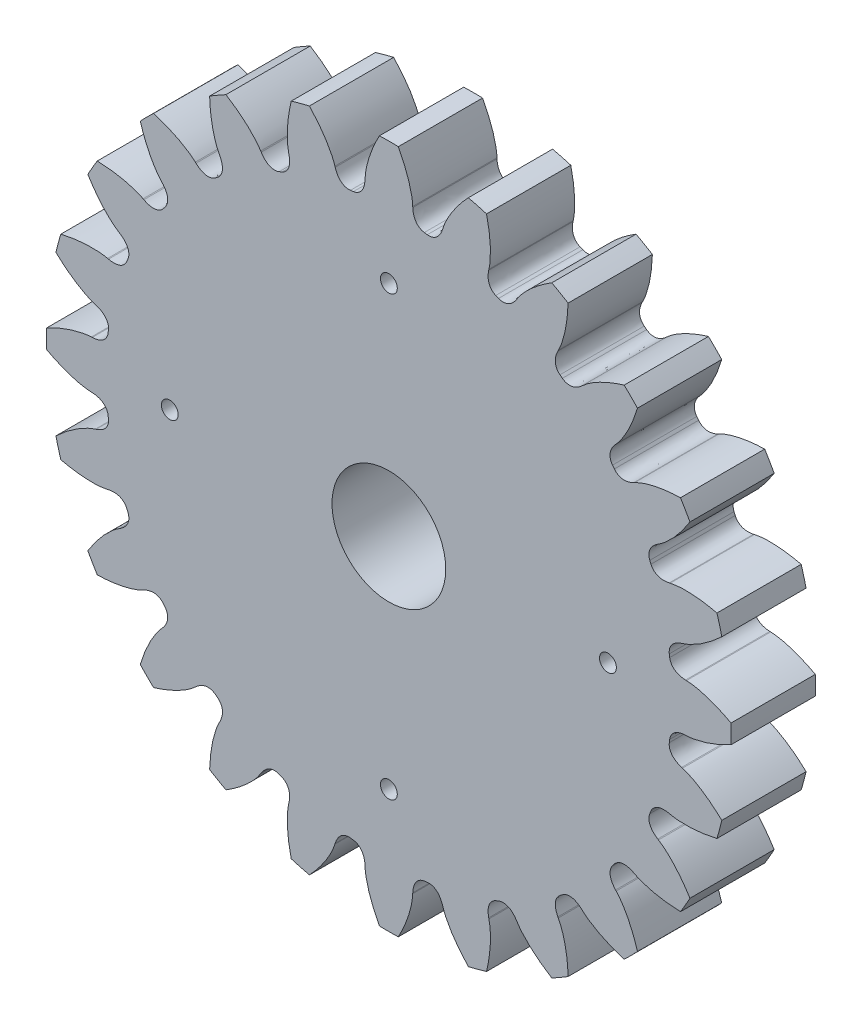
from build123d import *

# Parameters (mm, degrees)
BOSS_EXTRUDE1_DEPTH = 2.54
SKETCH2_R           = 0.254
SKETCH2_R_2         = 1.7145
CUT_EXTRUDE1_DEPTH  = 15.812319459


with BuildPart() as part:
    # Sketch1 → Boss-Extrude1 (new body)
    with BuildSketch(Plane.XY):
        with BuildLine():
            Line((3.016256703, 8.478973751), (3.010500812, 8.452042106))
            add(Edge.make_bspline(
                [(3.010500812, 8.452042106), (3.004237174, 8.425648336), (2.99688827, 8.381281904), (2.991380055, 8.318580234), (2.990974755, 8.26398578), (2.99590325, 8.207108487), (3.008355394, 8.146471227), (3.032122741, 8.081048479), (3.089990682, 7.983054513), (3.163339405, 7.924703305), (3.223040797, 7.900689665)],
                knots=[0, 0, 0, 0, 0.126202457, 0.208952284, 0.292707643, 0.37994875, 0.474167945, 0.579987459, 0.702457265, 1, 1, 1, 1], degree=3))
            ThreePointArc((3.223040797, 7.900689665), (3.265365975, 7.883290824), (3.307597234, 7.865665242))
            add(Edge.make_bspline(
                [(3.307597234, 7.865665242), (3.366792702, 7.84043019), (3.459918616, 7.829825346), (3.570129627, 7.85819873), (3.633196548, 7.887653546), (3.684878561, 7.921725569), (3.728581853, 7.958458917), (3.766899371, 7.997349615), (3.807341251, 8.045581287), (3.833516597, 8.082149552), (3.847750749, 8.105241827)],
                knots=[0, 0, 0, 0, 0.297542735, 0.420012541, 0.525832055, 0.62005125, 0.707292357, 0.791047716, 0.873797543, 1, 1, 1, 1], degree=3))
            Line((3.847750749, 8.105241827), (3.862724269, 8.128355406))
            add(Edge.make_bspline(
                [(3.862724269, 8.128355406), (3.891358957, 8.174937626), (3.947521117, 8.253427702), (4.041920253, 8.3671518), (4.146875377, 8.479989749), (4.278799081, 8.606717556), (4.439552178, 8.744566884), (4.630744241, 8.890618724), (4.792469065, 9.000256315), (4.889939742, 9.0615476), (4.91151267, 9.074890901)],
                knots=[0.278297263, 0.278297263, 0.278297263, 0.278297263, 0.361423458, 0.424900383, 0.502986534, 0.595681913, 0.702986522, 0.82490036, 0.96142343, 1, 1, 1, 1], degree=3))
            ThreePointArc((4.91151267, 9.074890901), (5.159375, 8.936299635), (5.403329722, 8.790940193))
            add(Edge.make_bspline(
                [(5.403329722, 8.790940193), (5.402560548, 8.76558584), (5.398216077, 8.650528115), (5.38412955, 8.455651513), (5.353240977, 8.21704841), (5.314236506, 8.00890748), (5.270448858, 7.831294297), (5.22520589, 7.683981519), (5.1739175, 7.545367421), (5.13402418, 7.457484525), (5.108000138, 7.409395047)],
                knots=[0, 0, 0, 0, 0.03857657, 0.17509964, 0.297013478, 0.404318087, 0.497013466, 0.575099617, 0.638576542, 0.721702737, 0.721702737, 0.721702737, 0.721702737], degree=3))
            Line((5.108000138, 7.409395047), (5.095469951, 7.384870809))
            add(Edge.make_bspline(
                [(5.095469951, 7.384870809), (5.082588531, 7.360997535), (5.064007157, 7.320044888), (5.042458244, 7.260905357), (5.02793667, 7.208276063), (5.017976304, 7.152061229), (5.014310073, 7.090267281), (5.020334915, 7.020922317), (5.050868348, 6.91129009), (5.106615371, 6.835943104), (5.1580673, 6.797295851)],
                knots=[0, 0, 0, 0, 0.126202457, 0.208952284, 0.292707643, 0.37994875, 0.474167945, 0.579987459, 0.702457265, 1, 1, 1, 1], degree=3))
            ThreePointArc((5.1580673, 6.797295851), (5.194447131, 6.769535299), (5.230677558, 6.74158004))
            add(Edge.make_bspline(
                [(5.230677558, 6.74158004), (5.281324677, 6.701883938), (5.368532668, 6.667537684), (5.482331902, 6.666419561), (5.550873337, 6.678547808), (5.609612816, 6.698082566), (5.661334245, 6.72225301), (5.708411779, 6.749901237), (5.75995891, 6.786022326), (5.794706916, 6.81456988), (5.814432772, 6.833191234)],
                knots=[0, 0, 0, 0, 0.297542735, 0.420012541, 0.525832055, 0.62005125, 0.707292357, 0.791047716, 0.873797543, 1, 1, 1, 1], degree=3))
            Line((5.814432772, 6.833191234), (5.834878315, 6.851641805))
            add(Edge.make_bspline(
                [(5.834878315, 6.851641805), (5.874593666, 6.889225572), (5.949156874, 6.950505327), (6.069773399, 7.035922076), (6.200356874, 7.11775078), (6.360584957, 7.206016074), (6.551538557, 7.297562337), (6.774016906, 7.389153435), (6.958607387, 7.453197751), (7.068620183, 7.487173318), (7.092911531, 7.494478473)],
                knots=[0.278297263, 0.278297263, 0.278297263, 0.278297263, 0.361423458, 0.424900383, 0.502986534, 0.595681913, 0.702986522, 0.82490036, 0.96142343, 1, 1, 1, 1], degree=3))
            ThreePointArc((7.092911531, 7.494478473), (7.296458098, 7.296458098), (7.494478473, 7.092911531))
            add(Edge.make_bspline(
                [(7.494478473, 7.092911531), (7.487173318, 7.068620183), (7.453197751, 6.958607387), (7.389153435, 6.774016906), (7.297562337, 6.551538557), (7.206016074, 6.360584957), (7.11775078, 6.200356874), (7.035922076, 6.069773399), (6.950505327, 5.949156874), (6.889225572, 5.874593666), (6.851641805, 5.834878315)],
                knots=[0, 0, 0, 0, 0.03857657, 0.17509964, 0.297013478, 0.404318087, 0.497013466, 0.575099617, 0.638576542, 0.721702737, 0.721702737, 0.721702737, 0.721702737], degree=3))
            Line((6.851641805, 5.834878315), (6.833191234, 5.814432772))
            add(Edge.make_bspline(
                [(6.833191234, 5.814432772), (6.81456988, 5.794706916), (6.786022326, 5.75995891), (6.749901237, 5.708411779), (6.72225301, 5.661334245), (6.698082566, 5.609612816), (6.678547808, 5.550873337), (6.666419561, 5.482331902), (6.667537684, 5.368532668), (6.701883938, 5.281324677), (6.74158004, 5.230677558)],
                knots=[0, 0, 0, 0, 0.126202457, 0.208952284, 0.292707643, 0.37994875, 0.474167945, 0.579987459, 0.702457265, 1, 1, 1, 1], degree=3))
            ThreePointArc((6.74158004, 5.230677558), (6.769535299, 5.194447131), (6.797295851, 5.1580673))
            add(Edge.make_bspline(
                [(6.797295851, 5.1580673), (6.835943104, 5.106615371), (6.91129009, 5.050868348), (7.020922317, 5.020334915), (7.090267281, 5.014310073), (7.152061229, 5.017976304), (7.208276063, 5.02793667), (7.260905357, 5.042458244), (7.320044888, 5.064007157), (7.360997535, 5.082588531), (7.384870809, 5.095469951)],
                knots=[0, 0, 0, 0, 0.297542735, 0.420012541, 0.525832055, 0.62005125, 0.707292357, 0.791047716, 0.873797543, 1, 1, 1, 1], degree=3))
            Line((7.384870809, 5.095469951), (7.409395047, 5.108000138))
            add(Edge.make_bspline(
                [(7.409395047, 5.108000138), (7.457484525, 5.13402418), (7.545367421, 5.1739175), (7.683981519, 5.22520589), (7.831294297, 5.270448858), (8.00890748, 5.314236506), (8.21704841, 5.353240977), (8.455651513, 5.38412955), (8.650528115, 5.398216077), (8.76558584, 5.402560548), (8.790940193, 5.403329722)],
                knots=[0.278297263, 0.278297263, 0.278297263, 0.278297263, 0.361423458, 0.424900383, 0.502986534, 0.595681913, 0.702986522, 0.82490036, 0.96142343, 1, 1, 1, 1], degree=3))
            ThreePointArc((8.790940193, 5.403329722), (8.936299635, 5.159375), (9.074890901, 4.91151267))
            add(Edge.make_bspline(
                [(9.074890901, 4.91151267), (9.0615476, 4.889939742), (9.000256315, 4.792469065), (8.890618724, 4.630744241), (8.744566884, 4.439552178), (8.606717556, 4.278799081), (8.479989749, 4.146875377), (8.3671518, 4.041920253), (8.253427702, 3.947521117), (8.174937626, 3.891358957), (8.128355406, 3.862724269)],
                knots=[0, 0, 0, 0, 0.03857657, 0.17509964, 0.297013478, 0.404318087, 0.497013466, 0.575099617, 0.638576542, 0.721702737, 0.721702737, 0.721702737, 0.721702737], degree=3))
            Line((8.128355406, 3.862724269), (8.105241827, 3.847750749))
            add(Edge.make_bspline(
                [(8.105241827, 3.847750749), (8.082149552, 3.833516597), (8.045581287, 3.807341251), (7.997349615, 3.766899371), (7.958458917, 3.728581853), (7.921725569, 3.684878561), (7.887653546, 3.633196548), (7.85819873, 3.570129627), (7.829825346, 3.459918616), (7.84043019, 3.366792702), (7.865665242, 3.307597234)],
                knots=[0, 0, 0, 0, 0.126202457, 0.208952284, 0.292707643, 0.37994875, 0.474167945, 0.579987459, 0.702457265, 1, 1, 1, 1], degree=3))
            ThreePointArc((7.865665242, 3.307597234), (7.883290824, 3.265365975), (7.900689665, 3.223040797))
            add(Edge.make_bspline(
                [(7.900689665, 3.223040797), (7.924703305, 3.163339405), (7.983054513, 3.089990682), (8.081048479, 3.032122741), (8.146471227, 3.008355394), (8.207108487, 2.99590325), (8.26398578, 2.990974755), (8.318580234, 2.991380055), (8.381281904, 2.99688827), (8.425648336, 3.004237174), (8.452042106, 3.010500812)],
                knots=[0, 0, 0, 0, 0.297542735, 0.420012541, 0.525832055, 0.62005125, 0.707292357, 0.791047716, 0.873797543, 1, 1, 1, 1], degree=3))
            Line((8.452042106, 3.010500812), (8.478973751, 3.016256703))
            add(Edge.make_bspline(
                [(8.478973751, 3.016256703), (8.532160138, 3.028947525), (8.627373647, 3.044735745), (8.774538997, 3.058400557), (8.928541956, 3.063974556), (9.111436193, 3.060300502), (9.322579993, 3.044105091), (9.561047444, 3.012186134), (9.752929647, 2.975354898), (9.865191307, 2.949772205), (9.889880809, 2.94395298)],
                knots=[0.278297263, 0.278297263, 0.278297263, 0.278297263, 0.361423458, 0.424900383, 0.502986534, 0.595681913, 0.702986522, 0.82490036, 0.96142343, 1, 1, 1, 1], degree=3))
            ThreePointArc((9.889880809, 2.94395298), (9.96714712, 2.670689022), (10.036864511, 2.395402336))
            add(Edge.make_bspline(
                [(10.036864511, 2.395402336), (10.018392388, 2.378017989), (9.933962285, 2.299731897), (9.78620304, 2.171894009), (9.595643648, 2.025017655), (9.420885459, 1.905420119), (9.26433143, 1.810791176), (9.128173957, 1.738616921), (8.993892619, 1.67686832), (8.903541191, 1.642934566), (8.851135018, 1.627331947)],
                knots=[0, 0, 0, 0, 0.03857657, 0.17509964, 0.297013478, 0.404318087, 0.497013466, 0.575099617, 0.638576542, 0.721702737, 0.721702737, 0.721702737, 0.721702737], degree=3))
            Line((8.851135018, 1.627331947), (8.824933583, 1.618850872))
            add(Edge.make_bspline(
                [(8.824933583, 1.618850872), (8.798944089, 1.611078457), (8.75684718, 1.595259578), (8.699791833, 1.568678997), (8.652309, 1.54173277), (8.605516067, 1.509025922), (8.55922873, 1.467923419), (8.514454643, 1.414628919), (8.458523349, 1.315516829), (8.444664082, 1.222819367), (8.453718356, 1.159109625)],
                knots=[0, 0, 0, 0, 0.126202457, 0.208952284, 0.292707643, 0.37994875, 0.474167945, 0.579987459, 0.702457265, 1, 1, 1, 1], degree=3))
            ThreePointArc((8.453718356, 1.159109625), (8.459813106, 1.113755525), (8.465664534, 1.068369391))
            add(Edge.make_bspline(
                [(8.465664534, 1.068369391), (8.473408072, 1.004487086), (8.510786965, 0.918535256), (8.590464542, 0.837276413), (8.647506621, 0.797386265), (8.702854865, 0.769664341), (8.756518523, 0.750182853), (8.809357615, 0.736444258), (8.871348409, 0.725536399), (8.916105128, 0.721152018), (8.9432207, 0.720371017)],
                knots=[0, 0, 0, 0, 0.297542735, 0.420012541, 0.525832055, 0.62005125, 0.707292357, 0.791047716, 0.873797543, 1, 1, 1, 1], degree=3))
            Line((8.9432207, 0.720371017), (8.970724407, 0.718960358))
            add(Edge.make_bspline(
                [(8.970724407, 0.718960358), (9.025383137, 0.717453101), (9.121438617, 0.708060281), (9.267126143, 0.683170281), (9.417324235, 0.648695452), (9.593035587, 0.597810076), (9.792793155, 0.527518474), (10.014873791, 0.434967211), (10.190685142, 0.3497282), (10.29250029, 0.29596176), (10.314842391, 0.283950707)],
                knots=[0.278297263, 0.278297263, 0.278297263, 0.278297263, 0.361423458, 0.424900383, 0.502986534, 0.595681913, 0.702986522, 0.82490036, 0.96142343, 1, 1, 1, 1], degree=3))
            ThreePointArc((10.314842391, 0.283950707), (10.31875, 0), (10.314842391, -0.283950707))
            add(Edge.make_bspline(
                [(10.314842391, -0.283950707), (10.29250029, -0.29596176), (10.190685142, -0.3497282), (10.014873791, -0.434967211), (9.792793155, -0.527518474), (9.593035587, -0.597810076), (9.417324235, -0.648695452), (9.267126143, -0.683170281), (9.121438617, -0.708060281), (9.025383137, -0.717453101), (8.970724407, -0.718960358)],
                knots=[0, 0, 0, 0, 0.03857657, 0.17509964, 0.297013478, 0.404318087, 0.497013466, 0.575099617, 0.638576542, 0.721702737, 0.721702737, 0.721702737, 0.721702737], degree=3))
            Line((8.970724407, -0.718960358), (8.9432207, -0.720371017))
            add(Edge.make_bspline(
                [(8.9432207, -0.720371017), (8.916105128, -0.721152018), (8.871348409, -0.725536399), (8.809357615, -0.736444258), (8.756518523, -0.750182853), (8.702854865, -0.769664341), (8.647506621, -0.797386265), (8.590464542, -0.837276413), (8.510786965, -0.918535256), (8.473408072, -1.004487086), (8.465664534, -1.068369391)],
                knots=[0, 0, 0, 0, 0.126202457, 0.208952284, 0.292707643, 0.37994875, 0.474167945, 0.579987459, 0.702457265, 1, 1, 1, 1], degree=3))
            ThreePointArc((8.465664534, -1.068369391), (8.459813106, -1.113755525), (8.453718356, -1.159109625))
            add(Edge.make_bspline(
                [(8.453718356, -1.159109625), (8.444664082, -1.222819367), (8.458523349, -1.315516829), (8.514454643, -1.414628919), (8.55922873, -1.467923419), (8.605516067, -1.509025922), (8.652309, -1.54173277), (8.699791833, -1.568678997), (8.75684718, -1.595259578), (8.798944089, -1.611078457), (8.824933583, -1.618850872)],
                knots=[0, 0, 0, 0, 0.297542735, 0.420012541, 0.525832055, 0.62005125, 0.707292357, 0.791047716, 0.873797543, 1, 1, 1, 1], degree=3))
            Line((8.824933583, -1.618850872), (8.851135018, -1.627331947))
            add(Edge.make_bspline(
                [(8.851135018, -1.627331947), (8.903541191, -1.642934566), (8.993892619, -1.67686832), (9.128173957, -1.738616921), (9.26433143, -1.810791176), (9.420885459, -1.905420119), (9.595643648, -2.025017655), (9.78620304, -2.171894009), (9.933962285, -2.299731897), (10.018392388, -2.378017989), (10.036864511, -2.395402336)],
                knots=[0.278297263, 0.278297263, 0.278297263, 0.278297263, 0.361423458, 0.424900383, 0.502986534, 0.595681913, 0.702986522, 0.82490036, 0.96142343, 1, 1, 1, 1], degree=3))
            ThreePointArc((10.036864511, -2.395402336), (9.96714712, -2.670689022), (9.889880809, -2.94395298))
            add(Edge.make_bspline(
                [(9.889880809, -2.94395298), (9.865191307, -2.949772205), (9.752929647, -2.975354898), (9.561047444, -3.012186134), (9.322579993, -3.044105091), (9.111436193, -3.060300502), (8.928541956, -3.063974556), (8.774538997, -3.058400557), (8.627373647, -3.044735745), (8.532160138, -3.028947525), (8.478973751, -3.016256703)],
                knots=[0, 0, 0, 0, 0.03857657, 0.17509964, 0.297013478, 0.404318087, 0.497013466, 0.575099617, 0.638576542, 0.721702737, 0.721702737, 0.721702737, 0.721702737], degree=3))
            Line((8.478973751, -3.016256703), (8.452042106, -3.010500812))
            add(Edge.make_bspline(
                [(8.452042106, -3.010500812), (8.425648336, -3.004237174), (8.381281904, -2.99688827), (8.318580234, -2.991380055), (8.26398578, -2.990974755), (8.207108487, -2.99590325), (8.146471227, -3.008355394), (8.081048479, -3.032122741), (7.983054513, -3.089990682), (7.924703305, -3.163339405), (7.900689665, -3.223040797)],
                knots=[0, 0, 0, 0, 0.126202457, 0.208952284, 0.292707643, 0.37994875, 0.474167945, 0.579987459, 0.702457265, 1, 1, 1, 1], degree=3))
            ThreePointArc((7.900689665, -3.223040797), (7.883290824, -3.265365975), (7.865665242, -3.307597234))
            add(Edge.make_bspline(
                [(7.865665242, -3.307597234), (7.84043019, -3.366792702), (7.829825346, -3.459918616), (7.85819873, -3.570129627), (7.887653546, -3.633196548), (7.921725569, -3.684878561), (7.958458917, -3.728581853), (7.997349615, -3.766899371), (8.045581287, -3.807341251), (8.082149552, -3.833516597), (8.105241827, -3.847750749)],
                knots=[0, 0, 0, 0, 0.297542735, 0.420012541, 0.525832055, 0.62005125, 0.707292357, 0.791047716, 0.873797543, 1, 1, 1, 1], degree=3))
            Line((8.105241827, -3.847750749), (8.128355406, -3.862724269))
            add(Edge.make_bspline(
                [(8.128355406, -3.862724269), (8.174937626, -3.891358957), (8.253427702, -3.947521117), (8.3671518, -4.041920253), (8.479989749, -4.146875377), (8.606717556, -4.278799081), (8.744566884, -4.439552178), (8.890618724, -4.630744241), (9.000256315, -4.792469065), (9.0615476, -4.889939742), (9.074890901, -4.91151267)],
                knots=[0.278297263, 0.278297263, 0.278297263, 0.278297263, 0.361423458, 0.424900383, 0.502986534, 0.595681913, 0.702986522, 0.82490036, 0.96142343, 1, 1, 1, 1], degree=3))
            ThreePointArc((9.074890901, -4.91151267), (8.936299635, -5.159375), (8.790940193, -5.403329722))
            add(Edge.make_bspline(
                [(8.790940193, -5.403329722), (8.76558584, -5.402560548), (8.650528115, -5.398216077), (8.455651513, -5.38412955), (8.21704841, -5.353240977), (8.00890748, -5.314236506), (7.831294297, -5.270448858), (7.683981519, -5.22520589), (7.545367421, -5.1739175), (7.457484525, -5.13402418), (7.409395047, -5.108000138)],
                knots=[0, 0, 0, 0, 0.03857657, 0.17509964, 0.297013478, 0.404318087, 0.497013466, 0.575099617, 0.638576542, 0.721702737, 0.721702737, 0.721702737, 0.721702737], degree=3))
            Line((7.409395047, -5.108000138), (7.384870809, -5.095469951))
            add(Edge.make_bspline(
                [(7.384870809, -5.095469951), (7.360997535, -5.082588531), (7.320044888, -5.064007157), (7.260905357, -5.042458244), (7.208276063, -5.02793667), (7.152061229, -5.017976304), (7.090267281, -5.014310073), (7.020922317, -5.020334915), (6.91129009, -5.050868348), (6.835943104, -5.106615371), (6.797295851, -5.1580673)],
                knots=[0, 0, 0, 0, 0.126202457, 0.208952284, 0.292707643, 0.37994875, 0.474167945, 0.579987459, 0.702457265, 1, 1, 1, 1], degree=3))
            ThreePointArc((6.797295851, -5.1580673), (6.769535299, -5.194447131), (6.74158004, -5.230677558))
            add(Edge.make_bspline(
                [(6.74158004, -5.230677558), (6.701883938, -5.281324677), (6.667537684, -5.368532668), (6.666419561, -5.482331902), (6.678547808, -5.550873337), (6.698082566, -5.609612816), (6.72225301, -5.661334245), (6.749901237, -5.708411779), (6.786022326, -5.75995891), (6.81456988, -5.794706916), (6.833191234, -5.814432772)],
                knots=[0, 0, 0, 0, 0.297542735, 0.420012541, 0.525832055, 0.62005125, 0.707292357, 0.791047716, 0.873797543, 1, 1, 1, 1], degree=3))
            Line((6.833191234, -5.814432772), (6.851641805, -5.834878315))
            add(Edge.make_bspline(
                [(6.851641805, -5.834878315), (6.889225572, -5.874593666), (6.950505327, -5.949156874), (7.035922076, -6.069773399), (7.11775078, -6.200356874), (7.206016074, -6.360584957), (7.297562337, -6.551538557), (7.389153435, -6.774016906), (7.453197751, -6.958607387), (7.487173318, -7.068620183), (7.494478473, -7.092911531)],
                knots=[0.278297263, 0.278297263, 0.278297263, 0.278297263, 0.361423458, 0.424900383, 0.502986534, 0.595681913, 0.702986522, 0.82490036, 0.96142343, 1, 1, 1, 1], degree=3))
            ThreePointArc((7.494478473, -7.092911531), (7.296458098, -7.296458098), (7.092911531, -7.494478473))
            add(Edge.make_bspline(
                [(7.092911531, -7.494478473), (7.068620183, -7.487173318), (6.958607387, -7.453197751), (6.774016906, -7.389153435), (6.551538557, -7.297562337), (6.360584957, -7.206016074), (6.200356874, -7.11775078), (6.069773399, -7.035922076), (5.949156874, -6.950505327), (5.874593666, -6.889225572), (5.834878315, -6.851641805)],
                knots=[0, 0, 0, 0, 0.03857657, 0.17509964, 0.297013478, 0.404318087, 0.497013466, 0.575099617, 0.638576542, 0.721702737, 0.721702737, 0.721702737, 0.721702737], degree=3))
            Line((5.834878315, -6.851641805), (5.814432772, -6.833191234))
            add(Edge.make_bspline(
                [(5.814432772, -6.833191234), (5.794706916, -6.81456988), (5.75995891, -6.786022326), (5.708411779, -6.749901237), (5.661334245, -6.72225301), (5.609612816, -6.698082566), (5.550873337, -6.678547808), (5.482331902, -6.666419561), (5.368532668, -6.667537684), (5.281324677, -6.701883938), (5.230677558, -6.74158004)],
                knots=[0, 0, 0, 0, 0.126202457, 0.208952284, 0.292707643, 0.37994875, 0.474167945, 0.579987459, 0.702457265, 1, 1, 1, 1], degree=3))
            ThreePointArc((5.230677558, -6.74158004), (5.194447131, -6.769535299), (5.1580673, -6.797295851))
            add(Edge.make_bspline(
                [(5.1580673, -6.797295851), (5.106615371, -6.835943104), (5.050868348, -6.91129009), (5.020334915, -7.020922317), (5.014310073, -7.090267281), (5.017976304, -7.152061229), (5.02793667, -7.208276063), (5.042458244, -7.260905357), (5.064007157, -7.320044888), (5.082588531, -7.360997535), (5.095469951, -7.384870809)],
                knots=[0, 0, 0, 0, 0.297542735, 0.420012541, 0.525832055, 0.62005125, 0.707292357, 0.791047716, 0.873797543, 1, 1, 1, 1], degree=3))
            Line((5.095469951, -7.384870809), (5.108000138, -7.409395047))
            add(Edge.make_bspline(
                [(5.108000138, -7.409395047), (5.13402418, -7.457484525), (5.1739175, -7.545367421), (5.22520589, -7.683981519), (5.270448858, -7.831294297), (5.314236506, -8.00890748), (5.353240977, -8.21704841), (5.38412955, -8.455651513), (5.398216077, -8.650528115), (5.402560548, -8.76558584), (5.403329722, -8.790940193)],
                knots=[0.278297263, 0.278297263, 0.278297263, 0.278297263, 0.361423458, 0.424900383, 0.502986534, 0.595681913, 0.702986522, 0.82490036, 0.96142343, 1, 1, 1, 1], degree=3))
            ThreePointArc((5.403329722, -8.790940193), (5.159375, -8.936299635), (4.91151267, -9.074890901))
            add(Edge.make_bspline(
                [(4.91151267, -9.074890901), (4.889939742, -9.0615476), (4.792469065, -9.000256315), (4.630744241, -8.890618724), (4.439552178, -8.744566884), (4.278799081, -8.606717556), (4.146875377, -8.479989749), (4.041920253, -8.3671518), (3.947521117, -8.253427702), (3.891358957, -8.174937626), (3.862724269, -8.128355406)],
                knots=[0, 0, 0, 0, 0.03857657, 0.17509964, 0.297013478, 0.404318087, 0.497013466, 0.575099617, 0.638576542, 0.721702737, 0.721702737, 0.721702737, 0.721702737], degree=3))
            Line((3.862724269, -8.128355406), (3.847750749, -8.105241827))
            add(Edge.make_bspline(
                [(3.847750749, -8.105241827), (3.833516597, -8.082149552), (3.807341251, -8.045581287), (3.766899371, -7.997349615), (3.728581853, -7.958458917), (3.684878561, -7.921725569), (3.633196548, -7.887653546), (3.570129627, -7.85819873), (3.459918616, -7.829825346), (3.366792702, -7.84043019), (3.307597234, -7.865665242)],
                knots=[0, 0, 0, 0, 0.126202457, 0.208952284, 0.292707643, 0.37994875, 0.474167945, 0.579987459, 0.702457265, 1, 1, 1, 1], degree=3))
            ThreePointArc((3.307597234, -7.865665242), (3.265365975, -7.883290824), (3.223040797, -7.900689665))
            add(Edge.make_bspline(
                [(3.223040797, -7.900689665), (3.163339405, -7.924703305), (3.089990682, -7.983054513), (3.032122741, -8.081048479), (3.008355394, -8.146471227), (2.99590325, -8.207108487), (2.990974755, -8.26398578), (2.991380055, -8.318580234), (2.99688827, -8.381281904), (3.004237174, -8.425648336), (3.010500812, -8.452042106)],
                knots=[0, 0, 0, 0, 0.297542735, 0.420012541, 0.525832055, 0.62005125, 0.707292357, 0.791047716, 0.873797543, 1, 1, 1, 1], degree=3))
            Line((3.010500812, -8.452042106), (3.016256703, -8.478973751))
            add(Edge.make_bspline(
                [(3.016256703, -8.478973751), (3.028947525, -8.532160138), (3.044735745, -8.627373647), (3.058400557, -8.774538997), (3.063974556, -8.928541956), (3.060300502, -9.111436193), (3.044105091, -9.322579993), (3.012186134, -9.561047444), (2.975354898, -9.752929647), (2.949772205, -9.865191307), (2.94395298, -9.889880809)],
                knots=[0.278297263, 0.278297263, 0.278297263, 0.278297263, 0.361423458, 0.424900383, 0.502986534, 0.595681913, 0.702986522, 0.82490036, 0.96142343, 1, 1, 1, 1], degree=3))
            ThreePointArc((2.94395298, -9.889880809), (2.670689022, -9.96714712), (2.395402336, -10.036864511))
            add(Edge.make_bspline(
                [(2.395402336, -10.036864511), (2.378017989, -10.018392388), (2.299731897, -9.933962285), (2.171894009, -9.78620304), (2.025017655, -9.595643648), (1.905420119, -9.420885459), (1.810791176, -9.26433143), (1.738616921, -9.128173957), (1.67686832, -8.993892619), (1.642934566, -8.903541191), (1.627331947, -8.851135018)],
                knots=[0, 0, 0, 0, 0.03857657, 0.17509964, 0.297013478, 0.404318087, 0.497013466, 0.575099617, 0.638576542, 0.721702737, 0.721702737, 0.721702737, 0.721702737], degree=3))
            Line((1.627331947, -8.851135018), (1.618850872, -8.824933583))
            add(Edge.make_bspline(
                [(1.618850872, -8.824933583), (1.611078457, -8.798944089), (1.595259578, -8.75684718), (1.568678997, -8.699791833), (1.54173277, -8.652309), (1.509025922, -8.605516067), (1.467923419, -8.55922873), (1.414628919, -8.514454643), (1.315516829, -8.458523349), (1.222819367, -8.444664082), (1.159109625, -8.453718356)],
                knots=[0, 0, 0, 0, 0.126202457, 0.208952284, 0.292707643, 0.37994875, 0.474167945, 0.579987459, 0.702457265, 1, 1, 1, 1], degree=3))
            ThreePointArc((1.159109625, -8.453718356), (1.113755525, -8.459813106), (1.068369391, -8.465664534))
            add(Edge.make_bspline(
                [(1.068369391, -8.465664534), (1.004487086, -8.473408072), (0.918535256, -8.510786965), (0.837276413, -8.590464542), (0.797386265, -8.647506621), (0.769664341, -8.702854865), (0.750182853, -8.756518523), (0.736444258, -8.809357615), (0.725536399, -8.871348409), (0.721152018, -8.916105128), (0.720371017, -8.9432207)],
                knots=[0, 0, 0, 0, 0.297542735, 0.420012541, 0.525832055, 0.62005125, 0.707292357, 0.791047716, 0.873797543, 1, 1, 1, 1], degree=3))
            Line((0.720371017, -8.9432207), (0.718960358, -8.970724407))
            add(Edge.make_bspline(
                [(0.718960358, -8.970724407), (0.717453101, -9.025383137), (0.708060281, -9.121438617), (0.683170281, -9.267126143), (0.648695452, -9.417324235), (0.597810076, -9.593035587), (0.527518474, -9.792793155), (0.434967211, -10.014873791), (0.3497282, -10.190685142), (0.29596176, -10.29250029), (0.283950707, -10.314842391)],
                knots=[0.278297263, 0.278297263, 0.278297263, 0.278297263, 0.361423458, 0.424900383, 0.502986534, 0.595681913, 0.702986522, 0.82490036, 0.96142343, 1, 1, 1, 1], degree=3))
            ThreePointArc((0.283950707, -10.314842391), (0, -10.31875), (-0.283950707, -10.314842391))
            add(Edge.make_bspline(
                [(-0.283950707, -10.314842391), (-0.29596176, -10.29250029), (-0.3497282, -10.190685142), (-0.434967211, -10.014873791), (-0.527518474, -9.792793155), (-0.597810076, -9.593035587), (-0.648695452, -9.417324235), (-0.683170281, -9.267126143), (-0.708060281, -9.121438617), (-0.717453101, -9.025383137), (-0.718960358, -8.970724407)],
                knots=[0, 0, 0, 0, 0.03857657, 0.17509964, 0.297013478, 0.404318087, 0.497013466, 0.575099617, 0.638576542, 0.721702737, 0.721702737, 0.721702737, 0.721702737], degree=3))
            Line((-0.718960358, -8.970724407), (-0.720371017, -8.9432207))
            add(Edge.make_bspline(
                [(-0.720371017, -8.9432207), (-0.721152018, -8.916105128), (-0.725536399, -8.871348409), (-0.736444258, -8.809357615), (-0.750182853, -8.756518523), (-0.769664341, -8.702854865), (-0.797386265, -8.647506621), (-0.837276413, -8.590464542), (-0.918535256, -8.510786965), (-1.004487086, -8.473408072), (-1.068369391, -8.465664534)],
                knots=[0, 0, 0, 0, 0.126202457, 0.208952284, 0.292707643, 0.37994875, 0.474167945, 0.579987459, 0.702457265, 1, 1, 1, 1], degree=3))
            ThreePointArc((-1.068369391, -8.465664534), (-1.113755525, -8.459813106), (-1.159109625, -8.453718356))
            add(Edge.make_bspline(
                [(-1.159109625, -8.453718356), (-1.222819367, -8.444664082), (-1.315516829, -8.458523349), (-1.414628919, -8.514454643), (-1.467923419, -8.55922873), (-1.509025922, -8.605516067), (-1.54173277, -8.652309), (-1.568678997, -8.699791833), (-1.595259578, -8.75684718), (-1.611078457, -8.798944089), (-1.618850872, -8.824933583)],
                knots=[0, 0, 0, 0, 0.297542735, 0.420012541, 0.525832055, 0.62005125, 0.707292357, 0.791047716, 0.873797543, 1, 1, 1, 1], degree=3))
            Line((-1.618850872, -8.824933583), (-1.627331947, -8.851135018))
            add(Edge.make_bspline(
                [(-1.627331947, -8.851135018), (-1.642934566, -8.903541191), (-1.67686832, -8.993892619), (-1.738616921, -9.128173957), (-1.810791176, -9.26433143), (-1.905420119, -9.420885459), (-2.025017655, -9.595643648), (-2.171894009, -9.78620304), (-2.299731897, -9.933962285), (-2.378017989, -10.018392388), (-2.395402336, -10.036864511)],
                knots=[0.278297263, 0.278297263, 0.278297263, 0.278297263, 0.361423458, 0.424900383, 0.502986534, 0.595681913, 0.702986522, 0.82490036, 0.96142343, 1, 1, 1, 1], degree=3))
            ThreePointArc((-2.395402336, -10.036864511), (-2.670689022, -9.96714712), (-2.94395298, -9.889880809))
            add(Edge.make_bspline(
                [(-2.94395298, -9.889880809), (-2.949772205, -9.865191307), (-2.975354898, -9.752929647), (-3.012186134, -9.561047444), (-3.044105091, -9.322579993), (-3.060300502, -9.111436193), (-3.063974556, -8.928541956), (-3.058400557, -8.774538997), (-3.044735745, -8.627373647), (-3.028947525, -8.532160138), (-3.016256703, -8.478973751)],
                knots=[0, 0, 0, 0, 0.03857657, 0.17509964, 0.297013478, 0.404318087, 0.497013466, 0.575099617, 0.638576542, 0.721702737, 0.721702737, 0.721702737, 0.721702737], degree=3))
            Line((-3.016256703, -8.478973751), (-3.010500812, -8.452042106))
            add(Edge.make_bspline(
                [(-3.010500812, -8.452042106), (-3.004237174, -8.425648336), (-2.99688827, -8.381281904), (-2.991380055, -8.318580234), (-2.990974755, -8.26398578), (-2.99590325, -8.207108487), (-3.008355394, -8.146471227), (-3.032122741, -8.081048479), (-3.089990682, -7.983054513), (-3.163339405, -7.924703305), (-3.223040797, -7.900689665)],
                knots=[0, 0, 0, 0, 0.126202457, 0.208952284, 0.292707643, 0.37994875, 0.474167945, 0.579987459, 0.702457265, 1, 1, 1, 1], degree=3))
            ThreePointArc((-3.223040797, -7.900689665), (-3.265365975, -7.883290824), (-3.307597234, -7.865665242))
            add(Edge.make_bspline(
                [(-3.307597234, -7.865665242), (-3.366792702, -7.84043019), (-3.459918616, -7.829825346), (-3.570129627, -7.85819873), (-3.633196548, -7.887653546), (-3.684878561, -7.921725569), (-3.728581853, -7.958458917), (-3.766899371, -7.997349615), (-3.807341251, -8.045581287), (-3.833516597, -8.082149552), (-3.847750749, -8.105241827)],
                knots=[0, 0, 0, 0, 0.297542735, 0.420012541, 0.525832055, 0.62005125, 0.707292357, 0.791047716, 0.873797543, 1, 1, 1, 1], degree=3))
            Line((-3.847750749, -8.105241827), (-3.862724269, -8.128355406))
            add(Edge.make_bspline(
                [(-3.862724269, -8.128355406), (-3.891358957, -8.174937626), (-3.947521117, -8.253427702), (-4.041920253, -8.3671518), (-4.146875377, -8.479989749), (-4.278799081, -8.606717556), (-4.439552178, -8.744566884), (-4.630744241, -8.890618724), (-4.792469065, -9.000256315), (-4.889939742, -9.0615476), (-4.91151267, -9.074890901)],
                knots=[0.278297263, 0.278297263, 0.278297263, 0.278297263, 0.361423458, 0.424900383, 0.502986534, 0.595681913, 0.702986522, 0.82490036, 0.96142343, 1, 1, 1, 1], degree=3))
            ThreePointArc((-4.91151267, -9.074890901), (-5.159375, -8.936299635), (-5.403329722, -8.790940193))
            add(Edge.make_bspline(
                [(-5.403329722, -8.790940193), (-5.402560548, -8.76558584), (-5.398216077, -8.650528115), (-5.38412955, -8.455651513), (-5.353240977, -8.21704841), (-5.314236506, -8.00890748), (-5.270448858, -7.831294297), (-5.22520589, -7.683981519), (-5.1739175, -7.545367421), (-5.13402418, -7.457484525), (-5.108000138, -7.409395047)],
                knots=[0, 0, 0, 0, 0.03857657, 0.17509964, 0.297013478, 0.404318087, 0.497013466, 0.575099617, 0.638576542, 0.721702737, 0.721702737, 0.721702737, 0.721702737], degree=3))
            Line((-5.108000138, -7.409395047), (-5.095469951, -7.384870809))
            add(Edge.make_bspline(
                [(-5.095469951, -7.384870809), (-5.082588531, -7.360997535), (-5.064007157, -7.320044888), (-5.042458244, -7.260905357), (-5.02793667, -7.208276063), (-5.017976304, -7.152061229), (-5.014310073, -7.090267281), (-5.020334915, -7.020922317), (-5.050868348, -6.91129009), (-5.106615371, -6.835943104), (-5.1580673, -6.797295851)],
                knots=[0, 0, 0, 0, 0.126202457, 0.208952284, 0.292707643, 0.37994875, 0.474167945, 0.579987459, 0.702457265, 1, 1, 1, 1], degree=3))
            ThreePointArc((-5.1580673, -6.797295851), (-5.194447131, -6.769535299), (-5.230677558, -6.74158004))
            add(Edge.make_bspline(
                [(-5.230677558, -6.74158004), (-5.281324677, -6.701883938), (-5.368532668, -6.667537684), (-5.482331902, -6.666419561), (-5.550873337, -6.678547808), (-5.609612816, -6.698082566), (-5.661334245, -6.72225301), (-5.708411779, -6.749901237), (-5.75995891, -6.786022326), (-5.794706916, -6.81456988), (-5.814432772, -6.833191234)],
                knots=[0, 0, 0, 0, 0.297542735, 0.420012541, 0.525832055, 0.62005125, 0.707292357, 0.791047716, 0.873797543, 1, 1, 1, 1], degree=3))
            Line((-5.814432772, -6.833191234), (-5.834878315, -6.851641805))
            add(Edge.make_bspline(
                [(-5.834878315, -6.851641805), (-5.874593666, -6.889225572), (-5.949156874, -6.950505327), (-6.069773399, -7.035922076), (-6.200356874, -7.11775078), (-6.360584957, -7.206016074), (-6.551538557, -7.297562337), (-6.774016906, -7.389153435), (-6.958607387, -7.453197751), (-7.068620183, -7.487173318), (-7.092911531, -7.494478473)],
                knots=[0.278297263, 0.278297263, 0.278297263, 0.278297263, 0.361423458, 0.424900383, 0.502986534, 0.595681913, 0.702986522, 0.82490036, 0.96142343, 1, 1, 1, 1], degree=3))
            ThreePointArc((-7.092911531, -7.494478473), (-7.296458098, -7.296458098), (-7.494478473, -7.092911531))
            add(Edge.make_bspline(
                [(-7.494478473, -7.092911531), (-7.487173318, -7.068620183), (-7.453197751, -6.958607387), (-7.389153435, -6.774016906), (-7.297562337, -6.551538557), (-7.206016074, -6.360584957), (-7.11775078, -6.200356874), (-7.035922076, -6.069773399), (-6.950505327, -5.949156874), (-6.889225572, -5.874593666), (-6.851641805, -5.834878315)],
                knots=[0, 0, 0, 0, 0.03857657, 0.17509964, 0.297013478, 0.404318087, 0.497013466, 0.575099617, 0.638576542, 0.721702737, 0.721702737, 0.721702737, 0.721702737], degree=3))
            Line((-6.851641805, -5.834878315), (-6.833191234, -5.814432772))
            add(Edge.make_bspline(
                [(-6.833191234, -5.814432772), (-6.81456988, -5.794706916), (-6.786022326, -5.75995891), (-6.749901237, -5.708411779), (-6.72225301, -5.661334245), (-6.698082566, -5.609612816), (-6.678547808, -5.550873337), (-6.666419561, -5.482331902), (-6.667537684, -5.368532668), (-6.701883938, -5.281324677), (-6.74158004, -5.230677558)],
                knots=[0, 0, 0, 0, 0.126202457, 0.208952284, 0.292707643, 0.37994875, 0.474167945, 0.579987459, 0.702457265, 1, 1, 1, 1], degree=3))
            ThreePointArc((-6.74158004, -5.230677558), (-6.769535299, -5.194447131), (-6.797295851, -5.1580673))
            add(Edge.make_bspline(
                [(-6.797295851, -5.1580673), (-6.835943104, -5.106615371), (-6.91129009, -5.050868348), (-7.020922317, -5.020334915), (-7.090267281, -5.014310073), (-7.152061229, -5.017976304), (-7.208276063, -5.02793667), (-7.260905357, -5.042458244), (-7.320044888, -5.064007157), (-7.360997535, -5.082588531), (-7.384870809, -5.095469951)],
                knots=[0, 0, 0, 0, 0.297542735, 0.420012541, 0.525832055, 0.62005125, 0.707292357, 0.791047716, 0.873797543, 1, 1, 1, 1], degree=3))
            Line((-7.384870809, -5.095469951), (-7.409395047, -5.108000138))
            add(Edge.make_bspline(
                [(-7.409395047, -5.108000138), (-7.457484525, -5.13402418), (-7.545367421, -5.1739175), (-7.683981519, -5.22520589), (-7.831294297, -5.270448858), (-8.00890748, -5.314236506), (-8.21704841, -5.353240977), (-8.455651513, -5.38412955), (-8.650528115, -5.398216077), (-8.76558584, -5.402560548), (-8.790940193, -5.403329722)],
                knots=[0.278297263, 0.278297263, 0.278297263, 0.278297263, 0.361423458, 0.424900383, 0.502986534, 0.595681913, 0.702986522, 0.82490036, 0.96142343, 1, 1, 1, 1], degree=3))
            ThreePointArc((-8.790940193, -5.403329722), (-8.936299635, -5.159375), (-9.074890901, -4.91151267))
            add(Edge.make_bspline(
                [(-9.074890901, -4.91151267), (-9.0615476, -4.889939742), (-9.000256315, -4.792469065), (-8.890618724, -4.630744241), (-8.744566884, -4.439552178), (-8.606717556, -4.278799081), (-8.479989749, -4.146875377), (-8.3671518, -4.041920253), (-8.253427702, -3.947521117), (-8.174937626, -3.891358957), (-8.128355406, -3.862724269)],
                knots=[0, 0, 0, 0, 0.03857657, 0.17509964, 0.297013478, 0.404318087, 0.497013466, 0.575099617, 0.638576542, 0.721702737, 0.721702737, 0.721702737, 0.721702737], degree=3))
            Line((-8.128355406, -3.862724269), (-8.105241827, -3.847750749))
            add(Edge.make_bspline(
                [(-8.105241827, -3.847750749), (-8.082149552, -3.833516597), (-8.045581287, -3.807341251), (-7.997349615, -3.766899371), (-7.958458917, -3.728581853), (-7.921725569, -3.684878561), (-7.887653546, -3.633196548), (-7.85819873, -3.570129627), (-7.829825346, -3.459918616), (-7.84043019, -3.366792702), (-7.865665242, -3.307597234)],
                knots=[0, 0, 0, 0, 0.126202457, 0.208952284, 0.292707643, 0.37994875, 0.474167945, 0.579987459, 0.702457265, 1, 1, 1, 1], degree=3))
            ThreePointArc((-7.865665242, -3.307597234), (-7.883290824, -3.265365975), (-7.900689665, -3.223040797))
            add(Edge.make_bspline(
                [(-7.900689665, -3.223040797), (-7.924703305, -3.163339405), (-7.983054513, -3.089990682), (-8.081048479, -3.032122741), (-8.146471227, -3.008355394), (-8.207108487, -2.99590325), (-8.26398578, -2.990974755), (-8.318580234, -2.991380055), (-8.381281904, -2.99688827), (-8.425648336, -3.004237174), (-8.452042106, -3.010500812)],
                knots=[0, 0, 0, 0, 0.297542735, 0.420012541, 0.525832055, 0.62005125, 0.707292357, 0.791047716, 0.873797543, 1, 1, 1, 1], degree=3))
            Line((-8.452042106, -3.010500812), (-8.478973751, -3.016256703))
            add(Edge.make_bspline(
                [(-8.478973751, -3.016256703), (-8.532160138, -3.028947525), (-8.627373647, -3.044735745), (-8.774538997, -3.058400557), (-8.928541956, -3.063974556), (-9.111436193, -3.060300502), (-9.322579993, -3.044105091), (-9.561047444, -3.012186134), (-9.752929647, -2.975354898), (-9.865191307, -2.949772205), (-9.889880809, -2.94395298)],
                knots=[0.278297263, 0.278297263, 0.278297263, 0.278297263, 0.361423458, 0.424900383, 0.502986534, 0.595681913, 0.702986522, 0.82490036, 0.96142343, 1, 1, 1, 1], degree=3))
            ThreePointArc((-9.889880809, -2.94395298), (-9.96714712, -2.670689022), (-10.036864511, -2.395402336))
            add(Edge.make_bspline(
                [(-10.036864511, -2.395402336), (-10.018392388, -2.378017989), (-9.933962285, -2.299731897), (-9.78620304, -2.171894009), (-9.595643648, -2.025017655), (-9.420885459, -1.905420119), (-9.26433143, -1.810791176), (-9.128173957, -1.738616921), (-8.993892619, -1.67686832), (-8.903541191, -1.642934566), (-8.851135018, -1.627331947)],
                knots=[0, 0, 0, 0, 0.03857657, 0.17509964, 0.297013478, 0.404318087, 0.497013466, 0.575099617, 0.638576542, 0.721702737, 0.721702737, 0.721702737, 0.721702737], degree=3))
            Line((-8.851135018, -1.627331947), (-8.824933583, -1.618850872))
            add(Edge.make_bspline(
                [(-8.824933583, -1.618850872), (-8.798944089, -1.611078457), (-8.75684718, -1.595259578), (-8.699791833, -1.568678997), (-8.652309, -1.54173277), (-8.605516067, -1.509025922), (-8.55922873, -1.467923419), (-8.514454643, -1.414628919), (-8.458523349, -1.315516829), (-8.444664082, -1.222819367), (-8.453718356, -1.159109625)],
                knots=[0, 0, 0, 0, 0.126202457, 0.208952284, 0.292707643, 0.37994875, 0.474167945, 0.579987459, 0.702457265, 1, 1, 1, 1], degree=3))
            ThreePointArc((-8.453718356, -1.159109625), (-8.459813106, -1.113755525), (-8.465664534, -1.068369391))
            add(Edge.make_bspline(
                [(-8.465664534, -1.068369391), (-8.473408072, -1.004487086), (-8.510786965, -0.918535256), (-8.590464542, -0.837276413), (-8.647506621, -0.797386265), (-8.702854865, -0.769664341), (-8.756518523, -0.750182853), (-8.809357615, -0.736444258), (-8.871348409, -0.725536399), (-8.916105128, -0.721152018), (-8.9432207, -0.720371017)],
                knots=[0, 0, 0, 0, 0.297542735, 0.420012541, 0.525832055, 0.62005125, 0.707292357, 0.791047716, 0.873797543, 1, 1, 1, 1], degree=3))
            Line((-8.9432207, -0.720371017), (-8.970724407, -0.718960358))
            add(Edge.make_bspline(
                [(-8.970724407, -0.718960358), (-9.025383137, -0.717453101), (-9.121438617, -0.708060281), (-9.267126143, -0.683170281), (-9.417324235, -0.648695452), (-9.593035587, -0.597810076), (-9.792793155, -0.527518474), (-10.014873791, -0.434967211), (-10.190685142, -0.3497282), (-10.29250029, -0.29596176), (-10.314842391, -0.283950707)],
                knots=[0.278297263, 0.278297263, 0.278297263, 0.278297263, 0.361423458, 0.424900383, 0.502986534, 0.595681913, 0.702986522, 0.82490036, 0.96142343, 1, 1, 1, 1], degree=3))
            ThreePointArc((-10.314842391, -0.283950707), (-10.31875, 0), (-10.314842391, 0.283950707))
            add(Edge.make_bspline(
                [(-10.314842391, 0.283950707), (-10.29250029, 0.29596176), (-10.190685142, 0.3497282), (-10.014873791, 0.434967211), (-9.792793155, 0.527518474), (-9.593035587, 0.597810076), (-9.417324235, 0.648695452), (-9.267126143, 0.683170281), (-9.121438617, 0.708060281), (-9.025383137, 0.717453101), (-8.970724407, 0.718960358)],
                knots=[0, 0, 0, 0, 0.03857657, 0.17509964, 0.297013478, 0.404318087, 0.497013466, 0.575099617, 0.638576542, 0.721702737, 0.721702737, 0.721702737, 0.721702737], degree=3))
            Line((-8.970724407, 0.718960358), (-8.9432207, 0.720371017))
            add(Edge.make_bspline(
                [(-8.9432207, 0.720371017), (-8.916105128, 0.721152018), (-8.871348409, 0.725536399), (-8.809357615, 0.736444258), (-8.756518523, 0.750182853), (-8.702854865, 0.769664341), (-8.647506621, 0.797386265), (-8.590464542, 0.837276413), (-8.510786965, 0.918535256), (-8.473408072, 1.004487086), (-8.465664534, 1.068369391)],
                knots=[0, 0, 0, 0, 0.126202457, 0.208952284, 0.292707643, 0.37994875, 0.474167945, 0.579987459, 0.702457265, 1, 1, 1, 1], degree=3))
            ThreePointArc((-8.465664534, 1.068369391), (-8.459813106, 1.113755525), (-8.453718356, 1.159109625))
            add(Edge.make_bspline(
                [(-8.453718356, 1.159109625), (-8.444664082, 1.222819367), (-8.458523349, 1.315516829), (-8.514454643, 1.414628919), (-8.55922873, 1.467923419), (-8.605516067, 1.509025922), (-8.652309, 1.54173277), (-8.699791833, 1.568678997), (-8.75684718, 1.595259578), (-8.798944089, 1.611078457), (-8.824933583, 1.618850872)],
                knots=[0, 0, 0, 0, 0.297542735, 0.420012541, 0.525832055, 0.62005125, 0.707292357, 0.791047716, 0.873797543, 1, 1, 1, 1], degree=3))
            Line((-8.824933583, 1.618850872), (-8.851135018, 1.627331947))
            add(Edge.make_bspline(
                [(-8.851135018, 1.627331947), (-8.903541191, 1.642934566), (-8.993892619, 1.67686832), (-9.128173957, 1.738616921), (-9.26433143, 1.810791176), (-9.420885459, 1.905420119), (-9.595643648, 2.025017655), (-9.78620304, 2.171894009), (-9.933962285, 2.299731897), (-10.018392388, 2.378017989), (-10.036864511, 2.395402336)],
                knots=[0.278297263, 0.278297263, 0.278297263, 0.278297263, 0.361423458, 0.424900383, 0.502986534, 0.595681913, 0.702986522, 0.82490036, 0.96142343, 1, 1, 1, 1], degree=3))
            ThreePointArc((-10.036864511, 2.395402336), (-9.96714712, 2.670689022), (-9.889880809, 2.94395298))
            add(Edge.make_bspline(
                [(-9.889880809, 2.94395298), (-9.865191307, 2.949772205), (-9.752929647, 2.975354898), (-9.561047444, 3.012186134), (-9.322579993, 3.044105091), (-9.111436193, 3.060300502), (-8.928541956, 3.063974556), (-8.774538997, 3.058400557), (-8.627373647, 3.044735745), (-8.532160138, 3.028947525), (-8.478973751, 3.016256703)],
                knots=[0, 0, 0, 0, 0.03857657, 0.17509964, 0.297013478, 0.404318087, 0.497013466, 0.575099617, 0.638576542, 0.721702737, 0.721702737, 0.721702737, 0.721702737], degree=3))
            Line((-8.478973751, 3.016256703), (-8.452042106, 3.010500812))
            add(Edge.make_bspline(
                [(-8.452042106, 3.010500812), (-8.425648336, 3.004237174), (-8.381281904, 2.99688827), (-8.318580234, 2.991380055), (-8.26398578, 2.990974755), (-8.207108487, 2.99590325), (-8.146471227, 3.008355394), (-8.081048479, 3.032122741), (-7.983054513, 3.089990682), (-7.924703305, 3.163339405), (-7.900689665, 3.223040797)],
                knots=[0, 0, 0, 0, 0.126202457, 0.208952284, 0.292707643, 0.37994875, 0.474167945, 0.579987459, 0.702457265, 1, 1, 1, 1], degree=3))
            ThreePointArc((-7.900689665, 3.223040797), (-7.883290824, 3.265365975), (-7.865665242, 3.307597234))
            add(Edge.make_bspline(
                [(-7.865665242, 3.307597234), (-7.84043019, 3.366792702), (-7.829825346, 3.459918616), (-7.85819873, 3.570129627), (-7.887653546, 3.633196548), (-7.921725569, 3.684878561), (-7.958458917, 3.728581853), (-7.997349615, 3.766899371), (-8.045581287, 3.807341251), (-8.082149552, 3.833516597), (-8.105241827, 3.847750749)],
                knots=[0, 0, 0, 0, 0.297542735, 0.420012541, 0.525832055, 0.62005125, 0.707292357, 0.791047716, 0.873797543, 1, 1, 1, 1], degree=3))
            Line((-8.105241827, 3.847750749), (-8.128355406, 3.862724269))
            add(Edge.make_bspline(
                [(-8.128355406, 3.862724269), (-8.174937626, 3.891358957), (-8.253427702, 3.947521117), (-8.3671518, 4.041920253), (-8.479989749, 4.146875377), (-8.606717556, 4.278799081), (-8.744566884, 4.439552178), (-8.890618724, 4.630744241), (-9.000256315, 4.792469065), (-9.0615476, 4.889939742), (-9.074890901, 4.91151267)],
                knots=[0.278297263, 0.278297263, 0.278297263, 0.278297263, 0.361423458, 0.424900383, 0.502986534, 0.595681913, 0.702986522, 0.82490036, 0.96142343, 1, 1, 1, 1], degree=3))
            ThreePointArc((-9.074890901, 4.91151267), (-8.936299635, 5.159375), (-8.790940193, 5.403329722))
            add(Edge.make_bspline(
                [(-8.790940193, 5.403329722), (-8.76558584, 5.402560548), (-8.650528115, 5.398216077), (-8.455651513, 5.38412955), (-8.21704841, 5.353240977), (-8.00890748, 5.314236506), (-7.831294297, 5.270448858), (-7.683981519, 5.22520589), (-7.545367421, 5.1739175), (-7.457484525, 5.13402418), (-7.409395047, 5.108000138)],
                knots=[0, 0, 0, 0, 0.03857657, 0.17509964, 0.297013478, 0.404318087, 0.497013466, 0.575099617, 0.638576542, 0.721702737, 0.721702737, 0.721702737, 0.721702737], degree=3))
            Line((-7.409395047, 5.108000138), (-7.384870809, 5.095469951))
            add(Edge.make_bspline(
                [(-7.384870809, 5.095469951), (-7.360997535, 5.082588531), (-7.320044888, 5.064007157), (-7.260905357, 5.042458244), (-7.208276063, 5.02793667), (-7.152061229, 5.017976304), (-7.090267281, 5.014310073), (-7.020922317, 5.020334915), (-6.91129009, 5.050868348), (-6.835943104, 5.106615371), (-6.797295851, 5.1580673)],
                knots=[0, 0, 0, 0, 0.126202457, 0.208952284, 0.292707643, 0.37994875, 0.474167945, 0.579987459, 0.702457265, 1, 1, 1, 1], degree=3))
            ThreePointArc((-6.797295851, 5.1580673), (-6.769535299, 5.194447131), (-6.74158004, 5.230677558))
            add(Edge.make_bspline(
                [(-6.74158004, 5.230677558), (-6.701883938, 5.281324677), (-6.667537684, 5.368532668), (-6.666419561, 5.482331902), (-6.678547808, 5.550873337), (-6.698082566, 5.609612816), (-6.72225301, 5.661334245), (-6.749901237, 5.708411779), (-6.786022326, 5.75995891), (-6.81456988, 5.794706916), (-6.833191234, 5.814432772)],
                knots=[0, 0, 0, 0, 0.297542735, 0.420012541, 0.525832055, 0.62005125, 0.707292357, 0.791047716, 0.873797543, 1, 1, 1, 1], degree=3))
            Line((-6.833191234, 5.814432772), (-6.851641805, 5.834878315))
            add(Edge.make_bspline(
                [(-6.851641805, 5.834878315), (-6.889225572, 5.874593666), (-6.950505327, 5.949156874), (-7.035922076, 6.069773399), (-7.11775078, 6.200356874), (-7.206016074, 6.360584957), (-7.297562337, 6.551538557), (-7.389153435, 6.774016906), (-7.453197751, 6.958607387), (-7.487173318, 7.068620183), (-7.494478473, 7.092911531)],
                knots=[0.278297263, 0.278297263, 0.278297263, 0.278297263, 0.361423458, 0.424900383, 0.502986534, 0.595681913, 0.702986522, 0.82490036, 0.96142343, 1, 1, 1, 1], degree=3))
            ThreePointArc((-7.494478473, 7.092911531), (-7.296458098, 7.296458098), (-7.092911531, 7.494478473))
            add(Edge.make_bspline(
                [(-7.092911531, 7.494478473), (-7.068620183, 7.487173318), (-6.958607387, 7.453197751), (-6.774016906, 7.389153435), (-6.551538557, 7.297562337), (-6.360584957, 7.206016074), (-6.200356874, 7.11775078), (-6.069773399, 7.035922076), (-5.949156874, 6.950505327), (-5.874593666, 6.889225572), (-5.834878315, 6.851641805)],
                knots=[0, 0, 0, 0, 0.03857657, 0.17509964, 0.297013478, 0.404318087, 0.497013466, 0.575099617, 0.638576542, 0.721702737, 0.721702737, 0.721702737, 0.721702737], degree=3))
            Line((-5.834878315, 6.851641805), (-5.814432772, 6.833191234))
            add(Edge.make_bspline(
                [(-5.814432772, 6.833191234), (-5.794706916, 6.81456988), (-5.75995891, 6.786022326), (-5.708411779, 6.749901237), (-5.661334245, 6.72225301), (-5.609612816, 6.698082566), (-5.550873337, 6.678547808), (-5.482331902, 6.666419561), (-5.368532668, 6.667537684), (-5.281324677, 6.701883938), (-5.230677558, 6.74158004)],
                knots=[0, 0, 0, 0, 0.126202457, 0.208952284, 0.292707643, 0.37994875, 0.474167945, 0.579987459, 0.702457265, 1, 1, 1, 1], degree=3))
            ThreePointArc((-5.230677558, 6.74158004), (-5.194447131, 6.769535299), (-5.1580673, 6.797295851))
            add(Edge.make_bspline(
                [(-5.1580673, 6.797295851), (-5.106615371, 6.835943104), (-5.050868348, 6.91129009), (-5.020334915, 7.020922317), (-5.014310073, 7.090267281), (-5.017976304, 7.152061229), (-5.02793667, 7.208276063), (-5.042458244, 7.260905357), (-5.064007157, 7.320044888), (-5.082588531, 7.360997535), (-5.095469951, 7.384870809)],
                knots=[0, 0, 0, 0, 0.297542735, 0.420012541, 0.525832055, 0.62005125, 0.707292357, 0.791047716, 0.873797543, 1, 1, 1, 1], degree=3))
            Line((-5.095469951, 7.384870809), (-5.108000138, 7.409395047))
            add(Edge.make_bspline(
                [(-5.108000138, 7.409395047), (-5.13402418, 7.457484525), (-5.1739175, 7.545367421), (-5.22520589, 7.683981519), (-5.270448858, 7.831294297), (-5.314236506, 8.00890748), (-5.353240977, 8.21704841), (-5.38412955, 8.455651513), (-5.398216077, 8.650528115), (-5.402560548, 8.76558584), (-5.403329722, 8.790940193)],
                knots=[0.278297263, 0.278297263, 0.278297263, 0.278297263, 0.361423458, 0.424900383, 0.502986534, 0.595681913, 0.702986522, 0.82490036, 0.96142343, 1, 1, 1, 1], degree=3))
            ThreePointArc((-5.403329722, 8.790940193), (-5.159375, 8.936299635), (-4.91151267, 9.074890901))
            add(Edge.make_bspline(
                [(-4.91151267, 9.074890901), (-4.889939742, 9.0615476), (-4.792469065, 9.000256315), (-4.630744241, 8.890618724), (-4.439552178, 8.744566884), (-4.278799081, 8.606717556), (-4.146875377, 8.479989749), (-4.041920253, 8.3671518), (-3.947521117, 8.253427702), (-3.891358957, 8.174937626), (-3.862724269, 8.128355406)],
                knots=[0, 0, 0, 0, 0.03857657, 0.17509964, 0.297013478, 0.404318087, 0.497013466, 0.575099617, 0.638576542, 0.721702737, 0.721702737, 0.721702737, 0.721702737], degree=3))
            Line((-3.862724269, 8.128355406), (-3.847750749, 8.105241827))
            add(Edge.make_bspline(
                [(-3.847750749, 8.105241827), (-3.833516597, 8.082149552), (-3.807341251, 8.045581287), (-3.766899371, 7.997349615), (-3.728581853, 7.958458917), (-3.684878561, 7.921725569), (-3.633196548, 7.887653546), (-3.570129627, 7.85819873), (-3.459918616, 7.829825346), (-3.366792702, 7.84043019), (-3.307597234, 7.865665242)],
                knots=[0, 0, 0, 0, 0.126202457, 0.208952284, 0.292707643, 0.37994875, 0.474167945, 0.579987459, 0.702457265, 1, 1, 1, 1], degree=3))
            ThreePointArc((-3.307597234, 7.865665242), (-3.265365975, 7.883290824), (-3.223040797, 7.900689665))
            add(Edge.make_bspline(
                [(-3.223040797, 7.900689665), (-3.163339405, 7.924703305), (-3.089990682, 7.983054513), (-3.032122741, 8.081048479), (-3.008355394, 8.146471227), (-2.99590325, 8.207108487), (-2.990974755, 8.26398578), (-2.991380055, 8.318580234), (-2.99688827, 8.381281904), (-3.004237174, 8.425648336), (-3.010500812, 8.452042106)],
                knots=[0, 0, 0, 0, 0.297542735, 0.420012541, 0.525832055, 0.62005125, 0.707292357, 0.791047716, 0.873797543, 1, 1, 1, 1], degree=3))
            Line((-3.010500812, 8.452042106), (-3.016256703, 8.478973751))
            add(Edge.make_bspline(
                [(-3.016256703, 8.478973751), (-3.028947525, 8.532160138), (-3.044735745, 8.627373647), (-3.058400557, 8.774538997), (-3.063974556, 8.928541956), (-3.060300502, 9.111436193), (-3.044105091, 9.322579993), (-3.012186134, 9.561047444), (-2.975354898, 9.752929647), (-2.949772205, 9.865191307), (-2.94395298, 9.889880809)],
                knots=[0.278297263, 0.278297263, 0.278297263, 0.278297263, 0.361423458, 0.424900383, 0.502986534, 0.595681913, 0.702986522, 0.82490036, 0.96142343, 1, 1, 1, 1], degree=3))
            ThreePointArc((-2.94395298, 9.889880809), (-2.670689022, 9.96714712), (-2.395402336, 10.036864511))
            add(Edge.make_bspline(
                [(-2.395402336, 10.036864511), (-2.378017989, 10.018392388), (-2.299731897, 9.933962285), (-2.171894009, 9.78620304), (-2.025017655, 9.595643648), (-1.905420119, 9.420885459), (-1.810791176, 9.26433143), (-1.738616921, 9.128173957), (-1.67686832, 8.993892619), (-1.642934566, 8.903541191), (-1.627331947, 8.851135018)],
                knots=[0, 0, 0, 0, 0.03857657, 0.17509964, 0.297013478, 0.404318087, 0.497013466, 0.575099617, 0.638576542, 0.721702737, 0.721702737, 0.721702737, 0.721702737], degree=3))
            Line((-1.627331947, 8.851135018), (-1.618850872, 8.824933583))
            add(Edge.make_bspline(
                [(-1.618850872, 8.824933583), (-1.611078457, 8.798944089), (-1.595259578, 8.75684718), (-1.568678997, 8.699791833), (-1.54173277, 8.652309), (-1.509025922, 8.605516067), (-1.467923419, 8.55922873), (-1.414628919, 8.514454643), (-1.315516829, 8.458523349), (-1.222819367, 8.444664082), (-1.159109625, 8.453718356)],
                knots=[0, 0, 0, 0, 0.126202457, 0.208952284, 0.292707643, 0.37994875, 0.474167945, 0.579987459, 0.702457265, 1, 1, 1, 1], degree=3))
            ThreePointArc((-1.159109625, 8.453718356), (-1.113755525, 8.459813106), (-1.068369391, 8.465664534))
            add(Edge.make_bspline(
                [(-1.068369391, 8.465664534), (-1.004487086, 8.473408072), (-0.918535256, 8.510786965), (-0.837276413, 8.590464542), (-0.797386265, 8.647506621), (-0.769664341, 8.702854865), (-0.750182853, 8.756518523), (-0.736444258, 8.809357615), (-0.725536399, 8.871348409), (-0.721152018, 8.916105128), (-0.720371017, 8.9432207)],
                knots=[0, 0, 0, 0, 0.297542735, 0.420012541, 0.525832055, 0.62005125, 0.707292357, 0.791047716, 0.873797543, 1, 1, 1, 1], degree=3))
            Line((-0.720371017, 8.9432207), (-0.718960358, 8.970724407))
            add(Edge.make_bspline(
                [(-0.718960358, 8.970724407), (-0.717453101, 9.025383137), (-0.708060281, 9.121438617), (-0.683170281, 9.267126143), (-0.648695452, 9.417324235), (-0.597810076, 9.593035587), (-0.527518474, 9.792793155), (-0.434967211, 10.014873791), (-0.3497282, 10.190685142), (-0.29596176, 10.29250029), (-0.283950707, 10.314842391)],
                knots=[0.278297263, 0.278297263, 0.278297263, 0.278297263, 0.361423458, 0.424900383, 0.502986534, 0.595681913, 0.702986522, 0.82490036, 0.96142343, 1, 1, 1, 1], degree=3))
            ThreePointArc((-0.283950707, 10.314842391), (0, 10.31875), (0.283950707, 10.314842391))
            add(Edge.make_bspline(
                [(0.283950707, 10.314842391), (0.29596176, 10.29250029), (0.3497282, 10.190685142), (0.434967211, 10.014873791), (0.527518474, 9.792793155), (0.597810076, 9.593035587), (0.648695452, 9.417324235), (0.683170281, 9.267126143), (0.708060281, 9.121438617), (0.717453101, 9.025383137), (0.718960358, 8.970724407)],
                knots=[0, 0, 0, 0, 0.03857657, 0.17509964, 0.297013478, 0.404318087, 0.497013466, 0.575099617, 0.638576542, 0.721702737, 0.721702737, 0.721702737, 0.721702737], degree=3))
            Line((0.718960358, 8.970724407), (0.720371017, 8.9432207))
            add(Edge.make_bspline(
                [(0.720371017, 8.9432207), (0.721152018, 8.916105128), (0.725536399, 8.871348409), (0.736444258, 8.809357615), (0.750182853, 8.756518523), (0.769664341, 8.702854865), (0.797386265, 8.647506621), (0.837276413, 8.590464542), (0.918535256, 8.510786965), (1.004487086, 8.473408072), (1.068369391, 8.465664534)],
                knots=[0, 0, 0, 0, 0.126202457, 0.208952284, 0.292707643, 0.37994875, 0.474167945, 0.579987459, 0.702457265, 1, 1, 1, 1], degree=3))
            ThreePointArc((1.068369391, 8.465664534), (1.113755525, 8.459813106), (1.159109625, 8.453718356))
            add(Edge.make_bspline(
                [(1.159109625, 8.453718356), (1.222819367, 8.444664082), (1.315516829, 8.458523349), (1.414628919, 8.514454643), (1.467923419, 8.55922873), (1.509025922, 8.605516067), (1.54173277, 8.652309), (1.568678997, 8.699791833), (1.595259578, 8.75684718), (1.611078457, 8.798944089), (1.618850872, 8.824933583)],
                knots=[0, 0, 0, 0, 0.297542735, 0.420012541, 0.525832055, 0.62005125, 0.707292357, 0.791047716, 0.873797543, 1, 1, 1, 1], degree=3))
            Line((1.618850872, 8.824933583), (1.627331947, 8.851135018))
            add(Edge.make_bspline(
                [(1.627331947, 8.851135018), (1.642934566, 8.903541191), (1.67686832, 8.993892619), (1.738616921, 9.128173957), (1.810791176, 9.26433143), (1.905420119, 9.420885459), (2.025017655, 9.595643648), (2.171894009, 9.78620304), (2.299731897, 9.933962285), (2.378017989, 10.018392388), (2.395402336, 10.036864511)],
                knots=[0.278297263, 0.278297263, 0.278297263, 0.278297263, 0.361423458, 0.424900383, 0.502986534, 0.595681913, 0.702986522, 0.82490036, 0.96142343, 1, 1, 1, 1], degree=3))
            ThreePointArc((2.395402336, 10.036864511), (2.670689022, 9.96714712), (2.94395298, 9.889880809))
            add(Edge.make_bspline(
                [(2.94395298, 9.889880809), (2.949772205, 9.865191307), (2.975354898, 9.752929647), (3.012186134, 9.561047444), (3.044105091, 9.322579993), (3.060300502, 9.111436193), (3.063974556, 8.928541956), (3.058400557, 8.774538997), (3.044735745, 8.627373647), (3.028947525, 8.532160138), (3.016256703, 8.478973751)],
                knots=[0, 0, 0, 0, 0.03857657, 0.17509964, 0.297013478, 0.404318087, 0.497013466, 0.575099617, 0.638576542, 0.721702737, 0.721702737, 0.721702737, 0.721702737], degree=3))
        make_face()
    extrude(amount=BOSS_EXTRUDE1_DEPTH)

    # Sketch2 → Cut-Extrude1 (cut, through all)
    with BuildSketch(Plane.XY):
        with Locations((0, 6.604)):
            Circle(SKETCH2_R)
        with Locations((6.604, 0)):
            Circle(SKETCH2_R)
        with Locations((0, -6.604)):
            Circle(SKETCH2_R)
        with Locations((-6.604, 0)):
            Circle(SKETCH2_R)
        Circle(SKETCH2_R_2)
    extrude(amount=CUT_EXTRUDE1_DEPTH, mode=Mode.SUBTRACT)


solid = part.part
